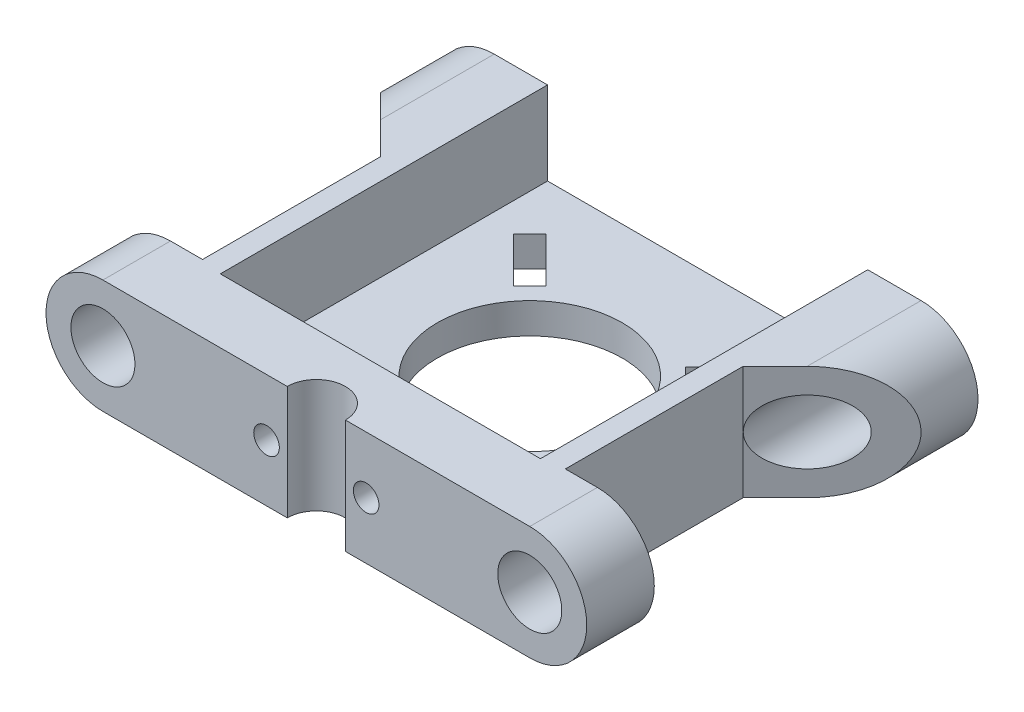
from build123d import *

# Parameters (mm, degrees)
SCHIZZO1_R        = 4.5
BASE_DEPTH        = 27.5
SCHIZZO3_R        = 13
HOLES_DEPTH       = 50.560569004
SCHIZZO5_W        = 45
SCHIZZO5_H        = 46
FLANGE_DEPTH      = 11.7
SCREW_HOLES_REACH = 69.328
SCHIZZO6_R        = 1.8
NUT_START         = -2.4
SCHIZZO7_R        = 1.8
NUT_HOLES_DEPTH   = 2.4


with BuildPart() as part:
    # Schizzo1 → Base (new, symmetric)
    with BuildSketch(Plane.XY):
        with BuildLine():
            Line((-30, -8), (30, -8))
            ThreePointArc((30, -8), (38, 0), (30, 8))
            Line((30, 8), (-30, 8))
            ThreePointArc((-30, 8), (-38, 0), (-30, -8))
        make_face()
        with Locations((-30, 0)):
            Circle(SCHIZZO1_R, mode=Mode.SUBTRACT)
        with Locations((30, 0)):
            Circle(SCHIZZO1_R, mode=Mode.SUBTRACT)
    extrude(amount=BASE_DEPTH, both=True)

    # Schizzo3 → Holes (cut, through all)
    with BuildSketch(Plane(origin=(0, 8, 0), x_dir=(1, 0, 0), z_dir=(0, 1, 0))):
        Polygon((9.828784258, 14.591525958), (12.091525958, 12.328784258), (18.455486989, 18.692745289), (16.192745289, 20.955486989), align=None)
        with BuildLine():
            Line((-4.09, -27.5), (4.09, -27.5))
            ThreePointArc((4.09, -27.5), (0, -23.41), (-4.09, -27.5))
        make_face()
        Polygon((38, -18), (38, 19.5), (25.5, 7), (25.5, -18), align=None)
        Polygon((-25.5, 7), (-38, 19.5), (-38, -18), (-25.5, -18), align=None)
        Polygon((-12.091525958, 12.328784258), (-9.828784258, 14.591525958), (-16.192745289, 20.955486989), (-18.455486989, 18.692745289), align=None)
        Polygon((12.091525958, -7.328784258), (9.828784258, -9.591525958), (16.192745289, -15.955486989), (18.455486989, -13.692745289), align=None)
        Polygon((-9.828784258, -9.591525958), (-12.091525958, -7.328784258), (-18.455486989, -13.692745289), (-16.192745289, -15.955486989), align=None)
        with Locations((0, 2.5)):
            Circle(SCHIZZO3_R)
    extrude(amount=-HOLES_DEPTH, mode=Mode.SUBTRACT)

    # Schizzo5 → Flange (cut)
    with BuildSketch(Plane(origin=(0, 8, 0), x_dir=(1, 0, 0), z_dir=(0, 1, 0))):
        with Locations((0, 4.5)):
            Rectangle(SCHIZZO5_W, SCHIZZO5_H)
    extrude(amount=-FLANGE_DEPTH, mode=Mode.SUBTRACT)

    # Schizzo6 → Screw holes (cut, up to next)
    with BuildSketch(Plane.XY.offset(27.5), mode=Mode.PRIVATE) as screw_holes_sk1:
        with Locations((7, 0)):
            Circle(SCHIZZO6_R)
    screw_holes_tool1 = extrude(screw_holes_sk1.sketch, amount=-SCREW_HOLES_REACH, mode=Mode.PRIVATE) & part.part
    # Schizzo6 → Screw holes (cut, up to next)
    with BuildSketch(Plane.XY.offset(27.5), mode=Mode.PRIVATE) as screw_holes_sk2:
        with Locations((-7, 0)):
            Circle(SCHIZZO6_R)
    screw_holes_tool2 = extrude(screw_holes_sk2.sketch, amount=-SCREW_HOLES_REACH, mode=Mode.PRIVATE) & part.part
    add(screw_holes_tool1.solids().sort_by_distance((7, 0, 27.5))[0], mode=Mode.SUBTRACT)
    add(screw_holes_tool2.solids().sort_by_distance((-7, 0, 27.5))[0], mode=Mode.SUBTRACT)

    # Schizzo7 → Nut holes (cut)
    # profile 1 of 2: a face of its own
    with BuildSketch(Plane(origin=(0, 0, 18.5), x_dir=(-1, 0, 0), z_dir=(0, 0, -1)).offset(NUT_START)):
        Polygon((-3.6, 0), (-5.3, 2.944486373), (-8.7, 2.944486373), (-10.4, 0), (-8.7, -2.944486373), (-5.3, -2.944486373), align=None)
    # profile 2 of 2: a face of its own
    with BuildSketch(Plane(origin=(0, 0, 18.5), x_dir=(-1, 0, 0), z_dir=(0, 0, -1)).offset(NUT_START)):
        Polygon((10.4, 0), (8.7, 2.944486373), (5.3, 2.944486373), (3.6, 0), (5.3, -2.944486373), (8.7, -2.944486373), align=None)
        with Locations((7, 0)):
            Circle(SCHIZZO7_R, mode=Mode.SUBTRACT)
    extrude(amount=NUT_HOLES_DEPTH, mode=Mode.SUBTRACT)


solid = part.part
